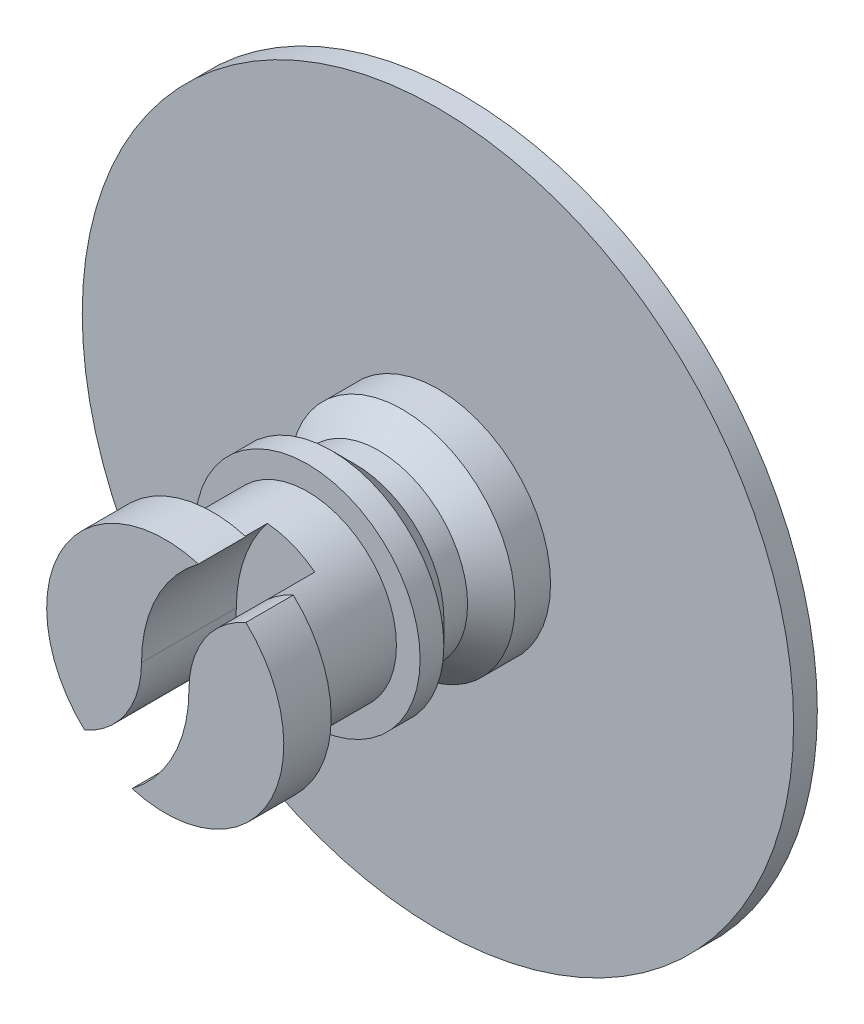
from build123d import *

# Parameters (mm, degrees)
EXTRUDE_1_DEPTH      = 14
EXTRUDE_1_DEPTH_BACK = 2
SKETCH_1_R           = 7.5
EXTRUDE_START        = 2
SKETCH_2_R           = 9.5
EXTRUDE_2_DEPTH      = 2
EXTRUDE_START_2      = 12
SKETCH_5_R           = 10
EXTRUDE_3_DEPTH      = 4
CUT_EXTRUDE_START    = 8
CUT_EXTRUDE_3_DEPTH  = 8


with BuildPart() as part:
    # Эскиз1 → Бобышка-Вытянуть1 (new, two sides: drawn at the far end of the back side and taken through both)
    with BuildSketch(Plane.XY.offset(-EXTRUDE_1_DEPTH_BACK)):
        Circle(SKETCH_1_R)
    extrude(amount=EXTRUDE_1_DEPTH + EXTRUDE_1_DEPTH_BACK)

    # Эскиз2 → Бобышка-Вытянуть2 (add)
    with BuildSketch(Plane.XY.offset(EXTRUDE_START)):
        Circle(SKETCH_2_R)
    extrude(amount=EXTRUDE_2_DEPTH)

    # Эскиз5 → Бобышка-Вытянуть3 (add)
    with BuildSketch(Plane.XY.offset(EXTRUDE_START_2)):
        Circle(SKETCH_5_R)
    extrude(amount=EXTRUDE_3_DEPTH)

    # Эскиз9 → Вырез-Вытянуть3 (cut)
    with BuildSketch(Plane.XY.offset(CUT_EXTRUDE_START)):
        with BuildLine():
            ThreePointArc((2, 0), (5.550280908, 6.648308055), (13.05, 7.395775821))
            ThreePointArc((13.05, 7.395775821), (11.283433415, 9.883528235), (9.05, 11.962336728))
            ThreePointArc((9.05, 11.962336728), (1.185239652, 8.142481194), (-2, 0))
            ThreePointArc((-2, 0), (-5.550280908, -6.648308055), (-13.05, -7.395775821))
            ThreePointArc((-13.05, -7.395775821), (-11.283433415, -9.883528235), (-9.05, -11.962336728))
            ThreePointArc((-9.05, -11.962336728), (-1.185239652, -8.142481194), (2, 0))
        make_face()
    extrude(amount=CUT_EXTRUDE_3_DEPTH, mode=Mode.SUBTRACT)

    # Эскиз12 → Повернуть1 (revolve)
    with BuildSketch(Plane(origin=(0, 0, 0), x_dir=(0, 0, -1), z_dir=(1, 0, 0))):
        Polygon((-2, 9.5), (0, 7.5), (-2, 7.5), align=None)
    revolve(axis=Axis((0, 0, 0), (0, 0, 1)))

    # Эскиз13 → Повернуть2 (revolve)
    with BuildSketch(Plane(origin=(0, 0, 0), x_dir=(0, 0, -1), z_dir=(1, 0, 0))):
        Polygon((2, 7.5), (4, 9.5), (7, 9.5), (7, 30), (9, 30), (9, 0), (2, 0), align=None)
    revolve(axis=Axis((0, 0, 0), (0, 0, 1)))


solid = part.part
